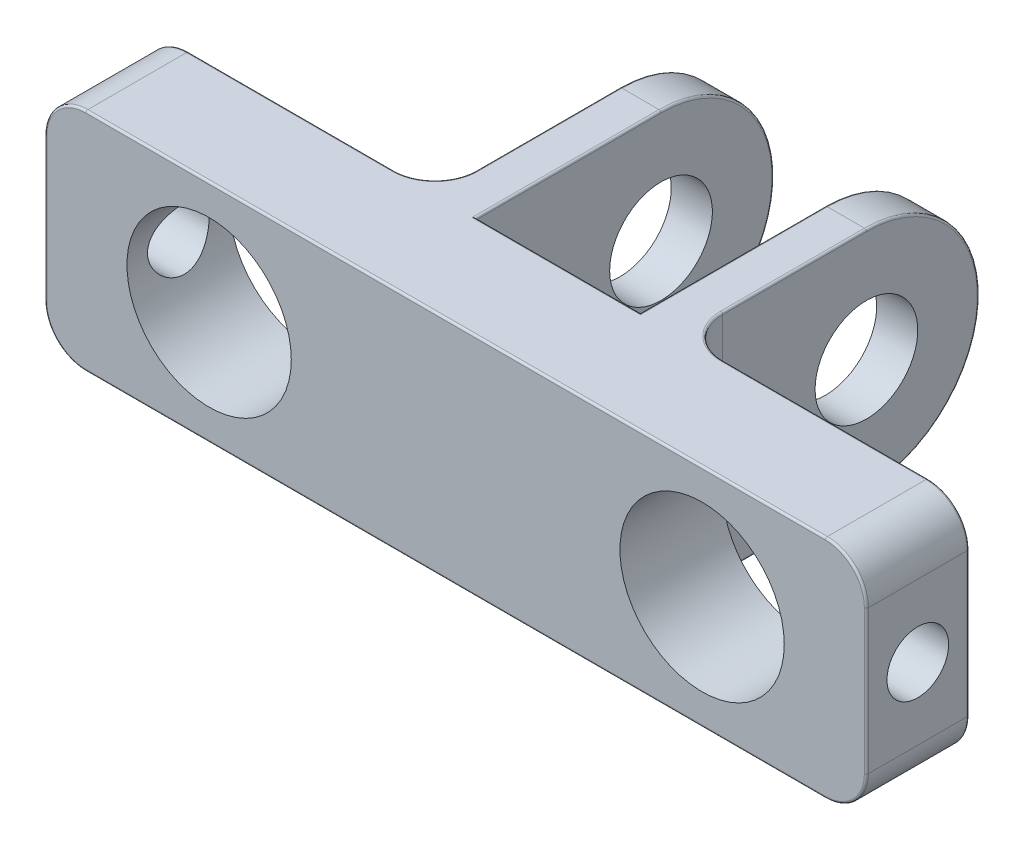
from build123d import *

# Parameters (mm, degrees)
BOSS_EXTRUDE1_DEPTH     = 127
SKETCH2_R               = 101.6
CUT_EXTRUDE1_DEPTH      = 127
SKETCH3_R               = 38.1
CUT_EXTRUDE2_DEPTH      = 127
SKETCH9_R               = 63.5
BOSS_EXTRUDE2_DEPTH     = 152.4
CUT_EXTRUDE3_DEPTH      = 687.85751805
CUT_EXTRUDE3_DEPTH_BACK = 687.85751805
SKETCH11_W              = 203.2
SKETCH11_H              = 368.3
FILLET1_R               = 50.8
FILLET2_R               = 2.54


with BuildPart() as part:
    # Sketch1 → Boss-Extrude1 (new body)
    with BuildSketch(Plane.XY):
        with BuildLine():
            Line((-457.2, 139.7), (457.2, 139.7))
            ThreePointArc((457.2, 139.7), (493.121024484, 124.821024484), (508, 88.9))
            Line((508, 88.9), (508, -88.9))
            ThreePointArc((508, -88.9), (493.121024484, -124.821024484), (457.2, -139.7))
            Line((457.2, -139.7), (-457.2, -139.7))
            ThreePointArc((-457.2, -139.7), (-493.121024484, -124.821024484), (-508, -88.9))
            Line((-508, -88.9), (-508, 88.9))
            ThreePointArc((-508, 88.9), (-493.121024484, 124.821024484), (-457.2, 139.7))
        make_face()
    extrude(amount=BOSS_EXTRUDE1_DEPTH)

    # Sketch2 → Cut-Extrude1 (cut)
    with BuildSketch(Plane.XY.offset(127)):
        with Locations((-304.8, 0)):
            Circle(SKETCH2_R)
        with Locations((304.8, 0)):
            Circle(SKETCH2_R)
    extrude(amount=-CUT_EXTRUDE1_DEPTH, mode=Mode.SUBTRACT)

    # Sketch3 → Cut-Extrude2 (cut)
    with BuildSketch(Plane(origin=(508, 0, 0), x_dir=(0, 0, -1), z_dir=(1, 0, 0))):
        with Locations((-63.5, 0)):
            Circle(SKETCH3_R)
    cut_extrude2 = extrude(amount=-CUT_EXTRUDE2_DEPTH, mode=Mode.SUBTRACT)

    # Mirror1: Cut-Extrude2 across plane
    add(cut_extrude2.mirror(Plane(origin=(0, 0, 0), x_dir=(0, 0, 1), z_dir=(1, 0, 0))), mode=Mode.SUBTRACT)

    # Sketch9 → Boss-Extrude2 (add, symmetric)
    with BuildSketch(Plane(origin=(0, 0, 0), x_dir=(0, 0, -1), z_dir=(1, 0, 0))):
        with BuildLine():
            Line((0, -88.9), (0, 88.9))
            Line((0, 88.9), (0, 139.7))
            Line((0, 139.7), (228.6, 139.7))
            ThreePointArc((228.6, 139.7), (368.3, 0), (228.6, -139.7))
            Line((228.6, -139.7), (0, -139.7))
            Line((0, -139.7), (0, -88.9))
        make_face()
        with Locations(Location((228.6, 0, 0), (0, 0, 180))):
            Circle(SKETCH9_R, mode=Mode.SUBTRACT)
    extrude(amount=BOSS_EXTRUDE2_DEPTH, both=True)

    # Sketch11 → Cut-Extrude3 (cut, two sides: drawn at the far end of the back side and taken through both)
    with BuildSketch(Plane(origin=(0, 139.7, 0), x_dir=(1, 0, 0), z_dir=(0, 1, 0)).offset(-CUT_EXTRUDE3_DEPTH_BACK)):
        with Locations((0, 184.15)):
            Rectangle(SKETCH11_W, SKETCH11_H)
    extrude(amount=CUT_EXTRUDE3_DEPTH + CUT_EXTRUDE3_DEPTH_BACK, mode=Mode.SUBTRACT)

    # Fillet1
    fillet1_edges = [part.edges().sort_by_distance(p)[0] for p in [
        (152.4, 0, 0),
        (-152.4, 0, 0),
    ]]
    fillet(fillet1_edges, radius=FILLET1_R - 0.0001)  # a hair under: the kernel refuses the full size

    # Fillet2
    fillet2_edges = [part.edges().sort_by_distance(p)[0] for p in [
        (-508, 0, 0),
        (-493.121024484, 124.821024484, 0),
        (330.19995, 139.7, 0),
        (493.121024484, 124.821024484, 0),
        (-493.121024484, 124.821024484, 127),
        (-508, 0, 127),
        (-493.121024484, -124.821024484, 127),
        (0, -139.7, 127),
        (493.121024484, -124.821024484, 127),
        (508, 0, 127),
        (152.4, 0, -368.3),
        (152.4, 139.7, -139.69995),
        (-152.4, 0, -368.3),
        (-152.4, 139.7, -139.69995),
        (493.121024484, 124.821024484, 127),
        (0, 139.7, 0),
        (0, -139.7, 0),
        (-101.6, 139.7, -114.3),
        (-101.6, 0, -368.3),
        (-101.6, -139.7, -114.3),
        (101.6, 0, -368.3),
        (101.6, 139.7, -114.3),
        (101.6, -139.7, -114.3),
        (508, 0, 0),
        (152.4, -139.7, -139.69995),
        (330.19995, -139.7, 0),
        (-330.19995, 139.7, 0),
        (0, 139.7, 127),
        (493.121024484, -124.821024484, 0),
        (-152.4, -139.7, -139.69995),
        (167.278946226, -139.7, -14.878946226),
        (167.278946226, 139.7, -14.878946226),
        (-167.278946226, -139.7, -14.878946226),
        (-167.278946226, 139.7, -14.878946226),
        (-330.19995, -139.7, 0),
        (-493.121024484, -124.821024484, 0),
    ]]
    fillet(fillet2_edges, radius=FILLET2_R)


solid = part.part
